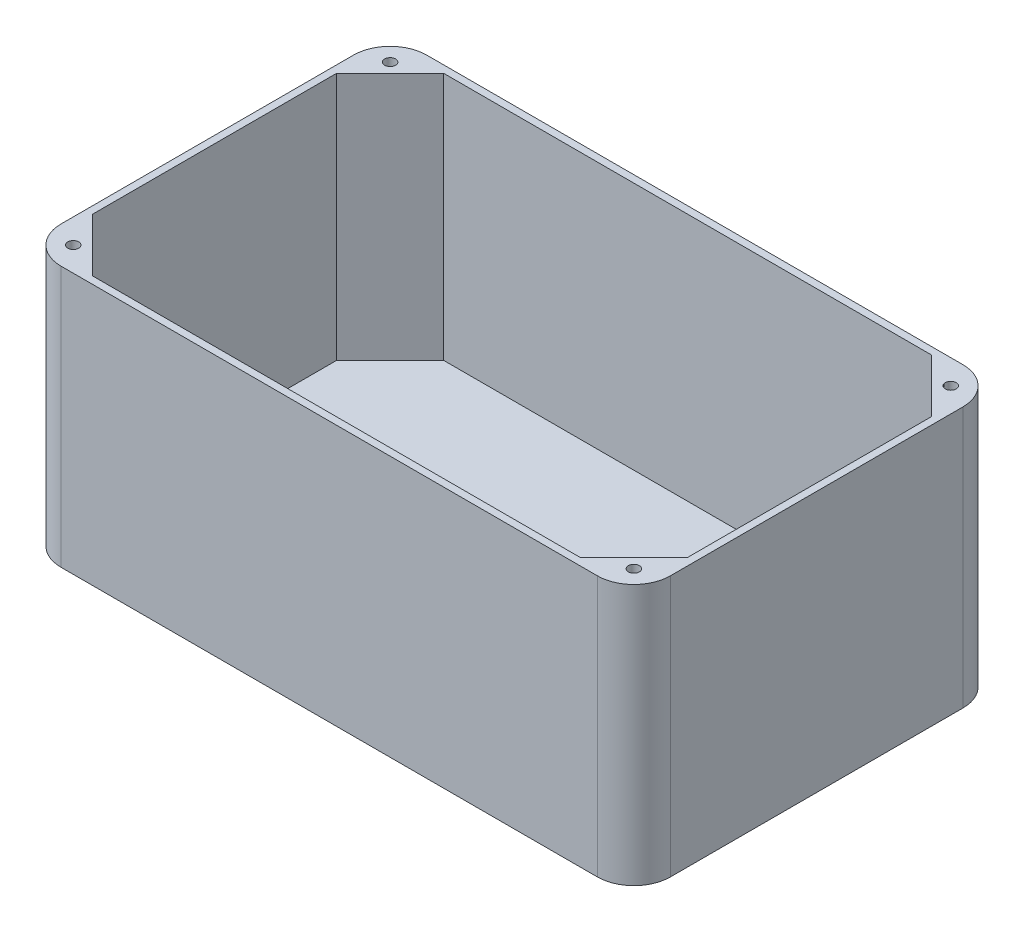
from build123d import *

# Parameters (mm, degrees)
CROQUIS1_W                       = 250
CROQUIS1_H                       = 150
SALIENTE_EXTRUIR1_DEPTH          = 110
REDONDEO1_R                      = 15
VACIADO2_T                       = -3
CROQUIS3_W                       = 250
CROQUIS3_H                       = 150
SALIENTE_EXTRUIR2_DEPTH          = 5
REDONDEO2_R                      = 15
CROQUIS4_W                       = 250
CROQUIS4_H                       = 150
CORTAR_EXTRUIR1_DEPTH            = 3
SALIENTE_EXTRUIR3_DEPTH          = 107
REDONDEO3_R                      = 15
TALADRO_DE_MARGEN_PARA_M41_D     = 4.5
TALADRO_DE_MARGEN_PARA_M41_DEPTH = 40
TALADRO_DE_MARGEN_PARA_M41_TIP   = 1.351936393


with BuildPart() as part:
    # Croquis1 → Saliente-Extruir1 (new body)
    with BuildSketch(Plane(origin=(0, 0, 0), x_dir=(1, 0, 0), z_dir=(0, 1, 0))):
        Rectangle(CROQUIS1_W, CROQUIS1_H)
    extrude(amount=SALIENTE_EXTRUIR1_DEPTH)

    # Redondeo1
    redondeo1_edges = [part.edges().sort_by_distance(p)[0] for p in [
        (125, 55, 75),
        (-125, 55, 75),
        (-125, 55, -75),
        (125, 55, -75),
    ]]
    fillet(redondeo1_edges, radius=REDONDEO1_R)

    # Vaciado2
    vaciado2_openings = [part.faces().sort_by_distance(p)[0] for p in [
        (0, 0, 0),
    ]]
    offset(amount=VACIADO2_T, openings=vaciado2_openings, kind=Kind.INTERSECTION)

    # Croquis3 → Saliente-Extruir2 (add)
    with BuildSketch(Plane.XZ):
        Rectangle(CROQUIS3_W, CROQUIS3_H)
    extrude(amount=-SALIENTE_EXTRUIR2_DEPTH)

    # Redondeo2
    redondeo2_edges = [part.edges().sort_by_distance(p)[0] for p in [
        (125, 2.5, 75),
        (125, 2.5, -75),
        (-125, 2.5, -75),
        (-125, 2.5, 75),
    ]]
    fillet(redondeo2_edges, radius=REDONDEO2_R - 0.0001)  # a hair under: the kernel refuses the full size

    # Croquis4 → Cortar-Extruir1 (cut)
    with BuildSketch(Plane(origin=(0, 110, 0), x_dir=(1, 0, 0), z_dir=(0, 1, 0))):
        Rectangle(CROQUIS4_W, CROQUIS4_H)
    extrude(amount=-CORTAR_EXTRUIR1_DEPTH, mode=Mode.SUBTRACT)

    # Croquis5 → Saliente-Extruir3 (add)
    with BuildSketch(Plane(origin=(0, 107, 0), x_dir=(1, 0, 0), z_dir=(0, 1, 0))):
        Polygon((-125, -47), (-125, -75), (-97, -75), align=None)
        Polygon((-97, 75), (-125, 75), (-125, 47), (-122, 50), (-100, 72), align=None)
        Polygon((97, -75), (125, -75), (125, -47), align=None)
        Polygon((97, 75), (125, 47), (125, 75), align=None)
    extrude(amount=-SALIENTE_EXTRUIR3_DEPTH)

    # Redondeo3
    redondeo3_edges = [part.edges().sort_by_distance(p)[0] for p in [
        (-125, 53.5, -75),
        (125, 53.5, 75),
        (-125, 53.5, 75),
        (125, 53.5, -75),
    ]]
    fillet(redondeo3_edges, radius=REDONDEO3_R)

    # Taladro de margen para M41
    with Locations(Plane(origin=(0, 107, 0), x_dir=(1, 0, 0), z_dir=(0, 1, 0))):
        with Locations((-115, 65), (115, 65), (115, -65), (-115, -65)):
            Hole(TALADRO_DE_MARGEN_PARA_M41_D / 2, depth=TALADRO_DE_MARGEN_PARA_M41_DEPTH)
            with Locations((0, 0, -(TALADRO_DE_MARGEN_PARA_M41_DEPTH + TALADRO_DE_MARGEN_PARA_M41_TIP / 2))):  # 118° drill point
                Cone(0, TALADRO_DE_MARGEN_PARA_M41_D / 2, TALADRO_DE_MARGEN_PARA_M41_TIP, mode=Mode.SUBTRACT)


solid = part.part
